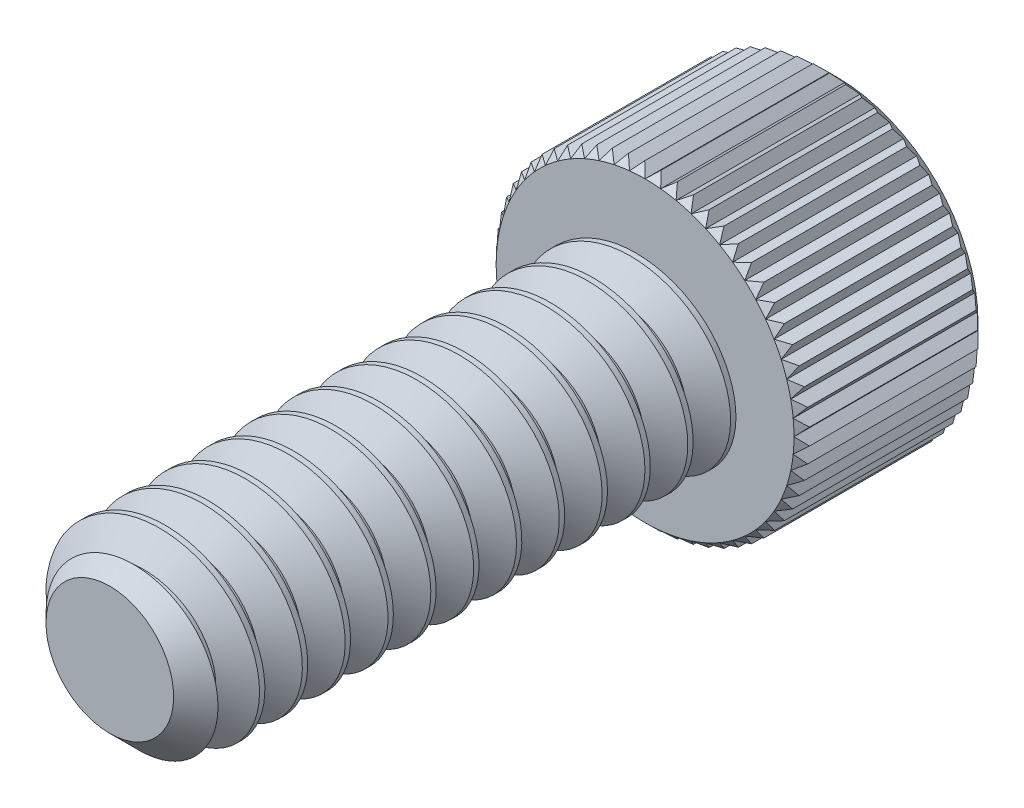
from build123d import *
from build123d.topology import SkipClean

# Parameters (mm, degrees)
SKETCH1_R          = 1.4224
EXTRUDE1_DEPTH     = 7.9375
CHAMFER3_SIZE      = 0.47625
CUT_SWEEP1_PITCH   = 0.635
SKETCH6_R          = 2.3241
EXTRUDE2_DEPTH     = 2.8448
CUT_EXTRUDE1_DEPTH = 1.7859375
CHAMFER1_SIZE      = 0.23241
CHAMFER2_SIZE      = 0.116205
CUT_EXTRUDE3_DEPTH = 9.591087792
CIRPATTERN1_COUNT  = 60


with BuildPart() as part:
    # Sketch1 → Extrude1 (new body)
    with BuildSketch(Plane.XY):
        Circle(SKETCH1_R)
    extrude(amount=-EXTRUDE1_DEPTH)

    # Chamfer3
    chamfer3_edges = [part.edges().sort_by_distance(p)[0] for p in [
        (-1.4224, 0, 0),
    ]]
    chamfer(chamfer3_edges, length=CHAMFER3_SIZE)

    # Cut-Sweep1: the profile of Sketch3 profile screwed along a right-hand helix of 13.5 turns, 6 arcs to a turn; built about Z, then put on its axis
    cut_sweep1_z = Axis((0, 0, 0), (0, 0, 1))
    cut_sweep1_corners = [(1.4227, 0, -0.555798205), (1.009955401, 0, -0.3175), (1.009955401, 0, -0.238125), (1.4227, 0, 0.000173205)]
    with BuildLine(mode=Mode.PRIVATE) as cut_sweep1_profile:
        Line(cut_sweep1_corners[0], cut_sweep1_corners[1])
        Line(cut_sweep1_corners[1], cut_sweep1_corners[2])
        Line(cut_sweep1_corners[2], cut_sweep1_corners[3])
        Line(cut_sweep1_corners[3], cut_sweep1_corners[0])
    cut_sweep1_cap = Face(cut_sweep1_profile.wire())
    cut_sweep1_turn_angles = [0, 30, 60, 90, 120, 150, 180, 210, 240, 270, 300, 330, 360]
    cut_sweep1_turn_weights = [1, 0.8660254037844387, 1, 0.8660254037844387, 1, 0.8660254037844387, 1, 0.8660254037844387, 1, 0.8660254037844387, 1, 0.8660254037844387, 1]
    cut_sweep1_turn_rails = [Edge.make_bspline([Vector(p[0], p[1], 0).rotate(cut_sweep1_z, cut_sweep1_turn_angles[k]) / cut_sweep1_turn_weights[k] + Vector(0, 0, p[2] + CUT_SWEEP1_PITCH * cut_sweep1_turn_angles[k] / 360) for k in range(13)], [0, 0, 0, 1, 1, 2, 2, 3, 3, 4, 4, 5, 5, 6, 6, 6], 2, cut_sweep1_turn_weights) for p in cut_sweep1_corners]
    cut_sweep1_turn_sides = [Face.make_surface_from_curves(cut_sweep1_turn_rails[p[0]], cut_sweep1_turn_rails[p[1]]) for p in [(0, 1), (1, 2), (2, 3), (3, 0)]]
    cut_sweep1_last_angles = [4680, 4710, 4740, 4770, 4800, 4830, 4860]
    cut_sweep1_last_weights = [1, 0.8660254037844387, 1, 0.8660254037844387, 1, 0.8660254037843632, 1]
    cut_sweep1_last_rails = [Edge.make_bspline([Vector(p[0], p[1], 0).rotate(cut_sweep1_z, cut_sweep1_last_angles[k]) / cut_sweep1_last_weights[k] + Vector(0, 0, p[2] + CUT_SWEEP1_PITCH * cut_sweep1_last_angles[k] / 360) for k in range(7)], [0, 0, 0, 1, 1, 2, 2, 3, 3, 3], 2, cut_sweep1_last_weights) for p in cut_sweep1_corners]
    cut_sweep1_last_sides = [Face.make_surface_from_curves(cut_sweep1_last_rails[p[0]], cut_sweep1_last_rails[p[1]]) for p in [(0, 1), (1, 2), (2, 3), (3, 0)]]
    cut_sweep1 = Plane(origin=(0, 0, 0), x_dir=(0, 1, 0), z_dir=(0, 0, -1)) * Solid(Shell([*[p.moved(Location((0, 0, CUT_SWEEP1_PITCH * i))) for i in range(13) for p in cut_sweep1_turn_sides], *cut_sweep1_last_sides, cut_sweep1_cap, cut_sweep1_cap.rotate(cut_sweep1_z, 4860).moved(Location((0, 0, CUT_SWEEP1_PITCH * 4860 / 360)))]))
    add(cut_sweep1, mode=Mode.SUBTRACT)

    # Sketch6 → Extrude2 (add)
    with BuildSketch(Plane(origin=(0, 0, -7.9375), x_dir=(-1, 0, 0), z_dir=(0, 0, -1))):
        Circle(SKETCH6_R)
    extrude(amount=EXTRUDE2_DEPTH)

    # Sketch7 → Cut-Extrude1 (cut)
    with BuildSketch(Plane(origin=(0, 0, -10.7823), x_dir=(-1, 0, 0), z_dir=(0, 0, -1))):
        Polygon((0, 1.374815329), (-1.190625, 0.687407664), (-1.190625, -0.687407664), (0, -1.374815329), (1.190625, -0.687407664), (1.190625, 0.687407664), align=None)
    extrude(amount=-CUT_EXTRUDE1_DEPTH, mode=Mode.SUBTRACT)

    # Cut-Extrude2 cone 1 section (through the dimple's axis) → Cut-Extrude2 (revolve, cut)
    with BuildSketch(Plane(origin=(0, 0, -10.7823), x_dir=(0, 1, 0), z_dir=(1, 0, 0))):
        Polygon((0, 0), (1.374815329, 0), (0, 1.374815329), align=None)
    revolve(axis=Axis((0, 0, -10.7823), (0, 0, 1)), mode=Mode.SUBTRACT)

    # Chamfer1
    chamfer1_edges = [part.edges().sort_by_distance(p)[0] for p in [
        (2.3241, 0, -10.7823),
    ]]
    chamfer(chamfer1_edges, length=CHAMFER1_SIZE)

    # Chamfer2
    chamfer2_edges = [part.edges().sort_by_distance(p)[0] for p in [
        (2.3241, 0, -7.9375),
    ]]
    chamfer(chamfer2_edges, length=CHAMFER2_SIZE)

    # Sketch10 → Cut-Extrude3 (cut, through all)
    with SkipClean():  # the faces are left unmerged after this step: merging them gives an invalid solid
        with BuildSketch(Plane.XY.offset(-7.9375)):
            Polygon((-0.250123709, 2.440305), (0, 2.207895), (0.250123709, 2.440305), align=None)
        cut_extrude3 = extrude(amount=-CUT_EXTRUDE3_DEPTH, mode=Mode.SUBTRACT)

    # CirPattern1: Cut-Extrude3 ×60 about axis
    cirpattern1_axis = Axis((0, 0, 0), (0, 0, 1))
    for i in range(1, CIRPATTERN1_COUNT):
        add(cut_extrude3.rotate(cirpattern1_axis, i * 360 / CIRPATTERN1_COUNT), mode=Mode.SUBTRACT)


solid = part.part
